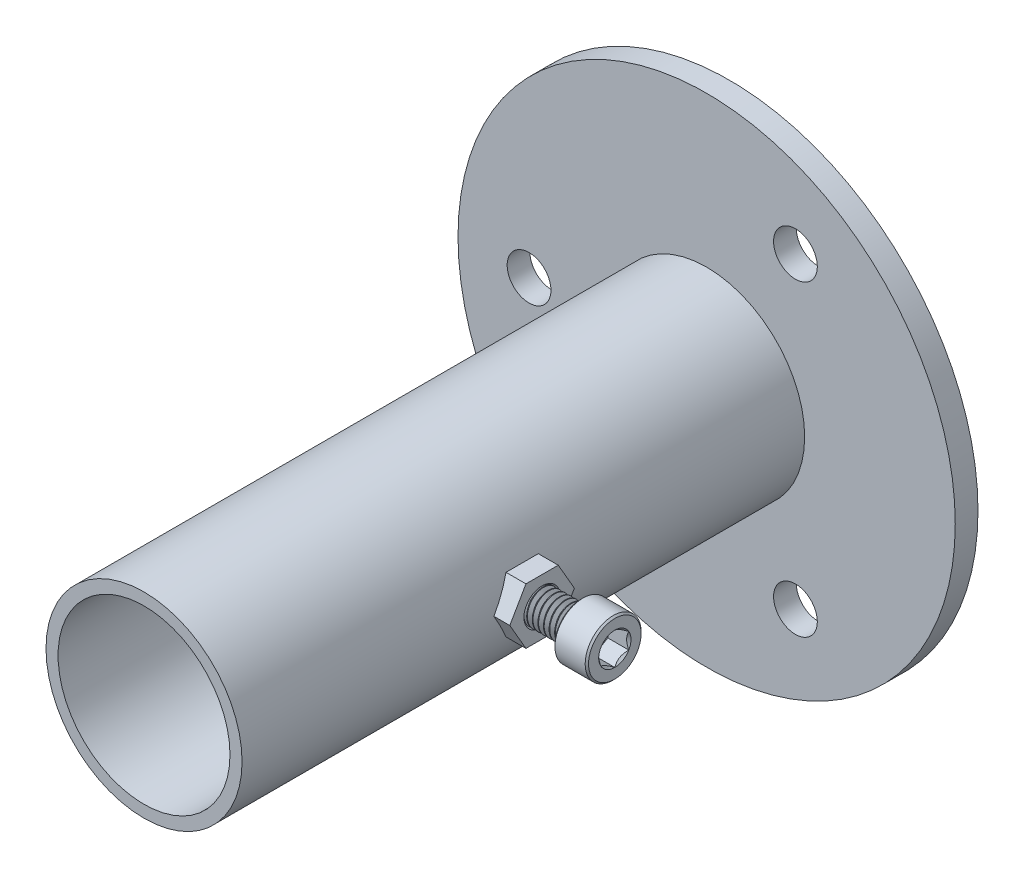
from build123d import *

# Parameters (mm, degrees)
SKETCH3_R               = 44.45
SKETCH3_R_2             = 9.5885
BOSS_EXTRUDE1_DEPTH     = 4.064
CUT_EXTRUDE2_REACH      = 64.993
SKETCH4_R               = 3.9116
SKETCH5_R               = 17.526
SKETCH5_R_2             = 15.367
BOSS_EXTRUDE2_DEPTH     = 100.584
CUT_EXTRUDE3_REACH      = 124.077
CUT_EXTRUDE3_END_RADIUS = 17.526
SKETCH7_R               = 3
BOSS_EXTRUDE3_DEPTH     = 5
CHAMFER1_SIZE           = 0.25
SKETCH8_R               = 3
BOSS_EXTRUDE4_DEPTH     = 12
CUT_SWEEP1_PITCH        = 1
SKETCH11_OUTSIDE_W      = 398.308
SKETCH11_OUTSIDE_H      = 382.56
SKETCH11_OUTSIDE_R      = 2.242227772
CUT_EXTRUDE4_DEPTH      = 129.472097722
CUT_EXTRUDE4_DRAFT      = -45
SKETCH12_R              = 5
BOSS_EXTRUDE5_DEPTH     = 6
CHAMFER2_SIZE           = 0.3
CUT_EXTRUDE5_DEPTH      = 3.75


with BuildPart() as part:
    # Sketch3 → Boss-Extrude1 (new body)
    with BuildSketch(Plane.XY):
        Circle(SKETCH3_R)
        Circle(SKETCH3_R_2, mode=Mode.SUBTRACT)
    extrude(amount=BOSS_EXTRUDE1_DEPTH)

    # Sketch4 → Cut-Extrude2 (cut, up to next)
    with BuildSketch(Plane.XY.offset(4.064), mode=Mode.PRIVATE) as cut_extrude2_sk1:
        with Locations((-31.75, 0)):
            Circle(SKETCH4_R)
    cut_extrude2_tool1 = extrude(cut_extrude2_sk1.sketch, amount=-CUT_EXTRUDE2_REACH, mode=Mode.PRIVATE) & part.part
    # Sketch4 → Cut-Extrude2 (cut, up to next)
    with BuildSketch(Plane.XY.offset(4.064), mode=Mode.PRIVATE) as cut_extrude2_sk2:
        with Locations((15.875, 27.49630657)):
            Circle(SKETCH4_R)
    cut_extrude2_tool2 = extrude(cut_extrude2_sk2.sketch, amount=-CUT_EXTRUDE2_REACH, mode=Mode.PRIVATE) & part.part
    # Sketch4 → Cut-Extrude2 (cut, up to next)
    with BuildSketch(Plane.XY.offset(4.064), mode=Mode.PRIVATE) as cut_extrude2_sk3:
        with Locations((15.875, -27.49630657)):
            Circle(SKETCH4_R)
    cut_extrude2_tool3 = extrude(cut_extrude2_sk3.sketch, amount=-CUT_EXTRUDE2_REACH, mode=Mode.PRIVATE) & part.part
    add(cut_extrude2_tool1.solids().sort_by_distance((-31.75, 0, 4.064))[0], mode=Mode.SUBTRACT)
    add(cut_extrude2_tool2.solids().sort_by_distance((15.875, 27.496307, 4.064))[0], mode=Mode.SUBTRACT)
    add(cut_extrude2_tool3.solids().sort_by_distance((15.875, -27.496307, 4.064))[0], mode=Mode.SUBTRACT)

    # Sketch5 → Boss-Extrude2 (add)
    with BuildSketch(Plane.XY.offset(4.064)):
        Circle(SKETCH5_R)
        Circle(SKETCH5_R_2, mode=Mode.SUBTRACT)
    extrude(amount=BOSS_EXTRUDE2_DEPTH)

    # Cut-Extrude3: up to this cylinder (the profile starts inside it)
    cut_extrude3_end = Plane(origin=(0, 0, 53.848), z_dir=(0, 0, -1)) * Cylinder(CUT_EXTRUDE3_END_RADIUS, 284.206, mode=Mode.PRIVATE)
    # Sketch6 → Cut-Extrude3 (cut, up to the surface)
    with BuildSketch(Plane(origin=(0, 0, 0), x_dir=(0, 0, -1), z_dir=(1, 0, 0)), mode=Mode.PRIVATE) as cut_extrude3_sk1:
        Polygon((-59.621502692, 0), (-56.734751346, -5), (-50.961248654, -5), (-48.074497308, 0), (-50.961248654, 5), (-56.734751346, 5), align=None)
    cut_extrude3_tool1 = extrude(cut_extrude3_sk1.sketch, amount=CUT_EXTRUDE3_REACH, mode=Mode.PRIVATE) & cut_extrude3_end
    add(cut_extrude3_tool1.solids().sort_by_distance((0, 0, 53.848))[0], mode=Mode.SUBTRACT)

    # Sketch7 → Boss-Extrude3 (add)
    with BuildSketch(Plane(origin=(15.367, 0, 0), x_dir=(0, 0, -1), z_dir=(1, 0, 0))):
        Polygon((-59.621502692, 0), (-56.734751346, -5), (-50.961248654, -5), (-48.074497308, 0), (-50.961248654, 5), (-56.734751346, 5), align=None)
        with Locations((-53.848, 0)):
            Circle(SKETCH7_R, mode=Mode.SUBTRACT)
    extrude(amount=BOSS_EXTRUDE3_DEPTH)

    # Chamfer1
    chamfer1_edges = [part.edges().sort_by_distance(p)[0] for p in [
        (15.367, 0, 56.848),
        (20.367, 0, 56.848),
    ]]
    chamfer(chamfer1_edges, length=CHAMFER1_SIZE)



with BuildPart() as body_2:
    # Sketch8 → Boss-Extrude4 (new body)
    with BuildSketch(Plane(origin=(15.367, 0, 0), x_dir=(0, 0, -1), z_dir=(1, 0, 0))):
        with Locations((-53.848, 0)):
            Circle(SKETCH8_R)
    extrude(amount=BOSS_EXTRUDE4_DEPTH)

    # Cut-Sweep1: arcs per turn and ends read off the stored shape
    # Cut-Sweep1: the profile of Sketch10 screwed along a right-hand helix through 14 turns, 8 arcs to a turn; built about Z, then put on its axis
    cut_sweep1_z = Axis((0, 0, 0), (0, 0, 1))
    cut_sweep1_corners = [(3.054126588, 0, -1.90625), (2.350480947, 0, -1.5), (2.350480947, 0, -1.375), (3.054126588, 0, -0.96875)]
    with BuildLine(mode=Mode.PRIVATE) as cut_sweep1_profile:
        Line(cut_sweep1_corners[0], cut_sweep1_corners[1])
        Line(cut_sweep1_corners[1], cut_sweep1_corners[2])
        Line(cut_sweep1_corners[2], cut_sweep1_corners[3])
        Line(cut_sweep1_corners[3], cut_sweep1_corners[0])
    cut_sweep1_cap = Face(cut_sweep1_profile.wire())
    cut_sweep1_turn_angles = [0, 22.5, 45, 67.5, 90, 112.5, 135, 157.5, 180, 202.5, 225, 247.5, 270, 292.5, 315, 337.5, 360]
    cut_sweep1_turn_weights = [1, 0.9238795325112867, 1, 0.9238795325112867, 1, 0.9238795325112867, 1, 0.9238795325112867, 1, 0.9238795325112867, 1, 0.9238795325112867, 1, 0.9238795325112867, 1, 0.9238795325112867, 1]
    cut_sweep1_turn_rails = [Edge.make_bspline([Vector(p[0], p[1], 0).rotate(cut_sweep1_z, cut_sweep1_turn_angles[k]) / cut_sweep1_turn_weights[k] + Vector(0, 0, p[2] + CUT_SWEEP1_PITCH * cut_sweep1_turn_angles[k] / 360) for k in range(17)], [0, 0, 0, 1, 1, 2, 2, 3, 3, 4, 4, 5, 5, 6, 6, 7, 7, 8, 8, 8], 2, cut_sweep1_turn_weights) for p in cut_sweep1_corners]
    cut_sweep1_turn_sides = [Face.make_surface_from_curves(cut_sweep1_turn_rails[p[0]], cut_sweep1_turn_rails[p[1]]) for p in [(0, 1), (1, 2), (2, 3), (3, 0)]]
    cut_sweep1 = Plane(origin=(15.367, 0, 53.848), x_dir=(0, 1, 0), z_dir=(1, 0, 0)) * Solid(Shell([*[p.moved(Location((0, 0, CUT_SWEEP1_PITCH * i))) for i in range(14) for p in cut_sweep1_turn_sides], cut_sweep1_cap, cut_sweep1_cap.rotate(cut_sweep1_z, 5040).moved(Location((0, 0, CUT_SWEEP1_PITCH * 5040 / 360)))]))
    add(cut_sweep1, mode=Mode.SUBTRACT)


with BuildPart() as cut_extrude4_tool:
    # Sketch11 outside → Cut-Extrude4 (with draft: the straight prism first)
    with BuildSketch(Plane.ZY.offset(-15.367)):
        with Locations((52.324, 0)):
            Rectangle(SKETCH11_OUTSIDE_W, SKETCH11_OUTSIDE_H)
        with Locations((53.848, 0)):
            Circle(SKETCH11_OUTSIDE_R, mode=Mode.SUBTRACT)
    extrude(amount=-CUT_EXTRUDE4_DEPTH)
    # Cut-Extrude4: the draft: its side faces are tilted about the plane it starts from
    cut_extrude4_sides = [cut_extrude4_tool.faces().sort_by_distance(p)[0] for p in [
        (80.103048861, -191.28, 52.324),
        (80.103048861, 0, 251.478),
        (80.103048861, 191.28, 52.324),
        (80.103048861, 0, -146.83),
        (80.103048861, 0, 51.605772228),
    ]]
    draft(cut_extrude4_sides, Plane.ZY.offset(-15.367), CUT_EXTRUDE4_DRAFT)


with BuildPart() as body_2_1:
    add(body_2.part)

    # Cut-Extrude4: cut by cut_extrude4_tool
    add(cut_extrude4_tool.part, mode=Mode.SUBTRACT)


with BuildPart() as part_1:
    add(part.part)

    add(body_2_1.part)  # Boss-Extrude5 merges body 2
    # Sketch12 → Boss-Extrude5 (add)
    with BuildSketch(Plane(origin=(27.367, 0, 0), x_dir=(0, 0, -1), z_dir=(1, 0, 0))):
        with Locations((-53.848, 0)):
            Circle(SKETCH12_R)
    extrude(amount=BOSS_EXTRUDE5_DEPTH)

    # Chamfer2
    chamfer2_edges = [part_1.edges().sort_by_distance(p)[0] for p in [
        (27.367, 0, 58.848),
        (33.367, 0, 58.848),
    ]]
    chamfer(chamfer2_edges, length=CHAMFER2_SIZE)

    # Sketch13 → Cut-Extrude5 (cut)
    with BuildSketch(Plane(origin=(33.367, 0, 0), x_dir=(0, 0, -1), z_dir=(1, 0, 0))):
        Polygon((-53.848, 2.886751346), (-56.348, 1.443375673), (-56.348, -1.443375673), (-53.848, -2.886751346), (-51.348, -1.443375673), (-51.348, 1.443375673), align=None)
    extrude(amount=-CUT_EXTRUDE5_DEPTH, mode=Mode.SUBTRACT)

    # Cut-Extrude6 cone 1 section (through the dimple's axis) → Cut-Extrude6 (revolve, cut)
    with BuildSketch(Plane(origin=(33.367, 0, 53.848), x_dir=(0, 0, -1), z_dir=(0, 1, 0))):
        Polygon((0, 0), (2.886751346, 0), (0, 2.886751346), align=None)
    revolve(axis=Axis((33.367, 0, 53.848), (-1, 0, 0)), mode=Mode.SUBTRACT)


solid = part_1.part
